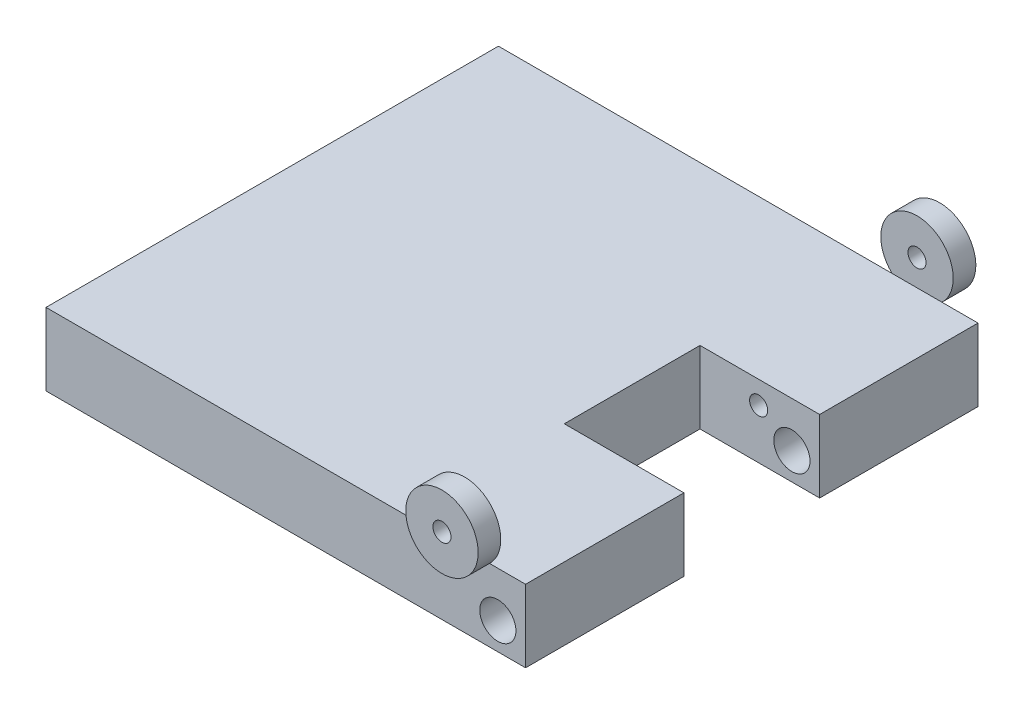
from build123d import *

# Parameters (mm, degrees)
SKETCH1_W           = 67.31
SKETCH1_H           = 10.16
SKETCH1_R           = 2.54
BOSS_EXTRUDE2_DEPTH = 63.5
CUT_EXTRUDE1_DEPTH  = 16.7894
SKETCH3_R           = 1.27
CUT_EXTRUDE2_DEPTH  = 12.7
CUT_EXTRUDE3_START  = -12.7
SKETCH4_R           = 1.27
CUT_EXTRUDE3_DEPTH  = 12.7
SKETCH5_R           = 5.08
SKETCH5_R_2         = 1.27
BOSS_EXTRUDE3_DEPTH = 3.175
BOSS_EXTRUDE4_START = 3.175
SKETCH6_R           = 5.08
SKETCH6_R_2         = 1.27
BOSS_EXTRUDE4_DEPTH = 3.175


with BuildPart() as part:
    # Sketch1 → Boss-Extrude2 (new body)
    with BuildSketch(Plane.XY):
        with Locations((-32.7152, 3.81)):
            Rectangle(SKETCH1_W, SKETCH1_H)
        with Locations((-2.954856457, 2.54)):
            Circle(SKETCH1_R, mode=Mode.SUBTRACT)
    extrude(amount=BOSS_EXTRUDE2_DEPTH)

    # Sketch2 → Cut-Extrude1 (cut)
    with BuildSketch(Plane(origin=(0.9398, 0, 0), x_dir=(0, 0, -1), z_dir=(1, 0, 0))):
        Polygon((-31.75, 8.89), (-22.225, 8.89), (-22.225, -1.27), (-41.275, -1.27), (-41.275, 8.89), align=None)
    extrude(amount=-CUT_EXTRUDE1_DEPTH, mode=Mode.SUBTRACT)

    # Sketch3 → Cut-Extrude2 (cut)
    with BuildSketch(Plane(origin=(0, 0, 41.275), x_dir=(-1, 0, 0), z_dir=(0, 0, -1))):
        with Locations((7.62, 5.715)):
            Circle(SKETCH3_R)
    extrude(amount=-CUT_EXTRUDE2_DEPTH, mode=Mode.SUBTRACT)

    # Sketch4 → Cut-Extrude3 (cut)
    with BuildSketch(Plane.XY.offset(22.225).offset(CUT_EXTRUDE3_START)):
        with Locations((-7.62, 5.715)):
            Circle(SKETCH4_R)
    extrude(amount=CUT_EXTRUDE3_DEPTH, mode=Mode.SUBTRACT)

    # Sketch5 → Boss-Extrude3 (add)
    with BuildSketch(Plane.XY.offset(63.5)):
        with Locations((-7.62, 12.573)):
            Circle(SKETCH5_R)
        with Locations((-7.62, 12.573)):
            Circle(SKETCH5_R_2, mode=Mode.SUBTRACT)
    extrude(amount=BOSS_EXTRUDE3_DEPTH)

    # Sketch6 → Boss-Extrude4 (add)
    with BuildSketch(Plane(origin=(0, 0, 0), x_dir=(-1, 0, 0), z_dir=(0, 0, -1)).offset(BOSS_EXTRUDE4_START)):
        with Locations((7.62, 12.573)):
            Circle(SKETCH6_R)
        with Locations((7.62, 12.573)):
            Circle(SKETCH6_R_2, mode=Mode.SUBTRACT)
    extrude(amount=-BOSS_EXTRUDE4_DEPTH)


solid = part.part
